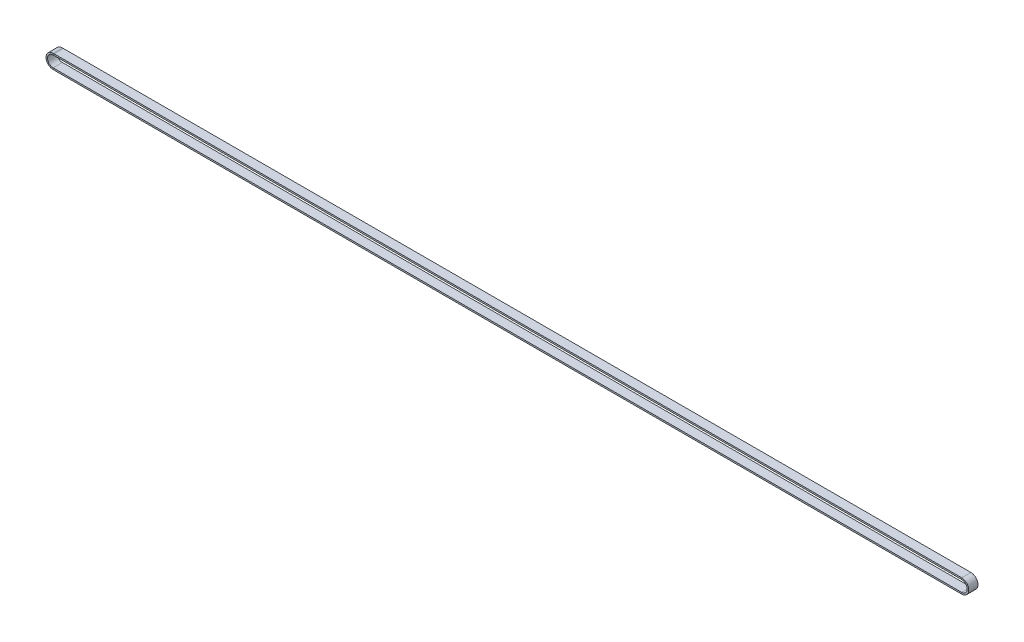
from build123d import *

# Parameters (mm, degrees)
SKETCH3_W = 9
SKETCH3_H = 1.5


with BuildPart() as part:
    # Sweep1: sweep along a path in Sketch2
    with BuildLine(Plane.XY.offset(-11.733366658)) as sweep1_path:
        Line((-1, -79.351548814), (883.520637828, -79.351548814))
        ThreePointArc((883.520637828, -79.351548814), (890.420637828, -86.251548814), (883.520637828, -93.151548814))
        Line((883.520637828, -93.151548814), (-1, -93.151548814))
        ThreePointArc((-1, -93.151548814), (-7.9, -86.251548814), (-1, -79.351548814))
    # Sketch3 → Sweep1 (sweep)
    with BuildSketch(Plane(origin=(0, 0, 0), x_dir=(0, 0, -1), z_dir=(1, 0, 0))):
        with Locations((7.233366658, -80.101548814)):
            Rectangle(SKETCH3_W, SKETCH3_H)
    sweep(path=sweep1_path.line)


solid = part.part
